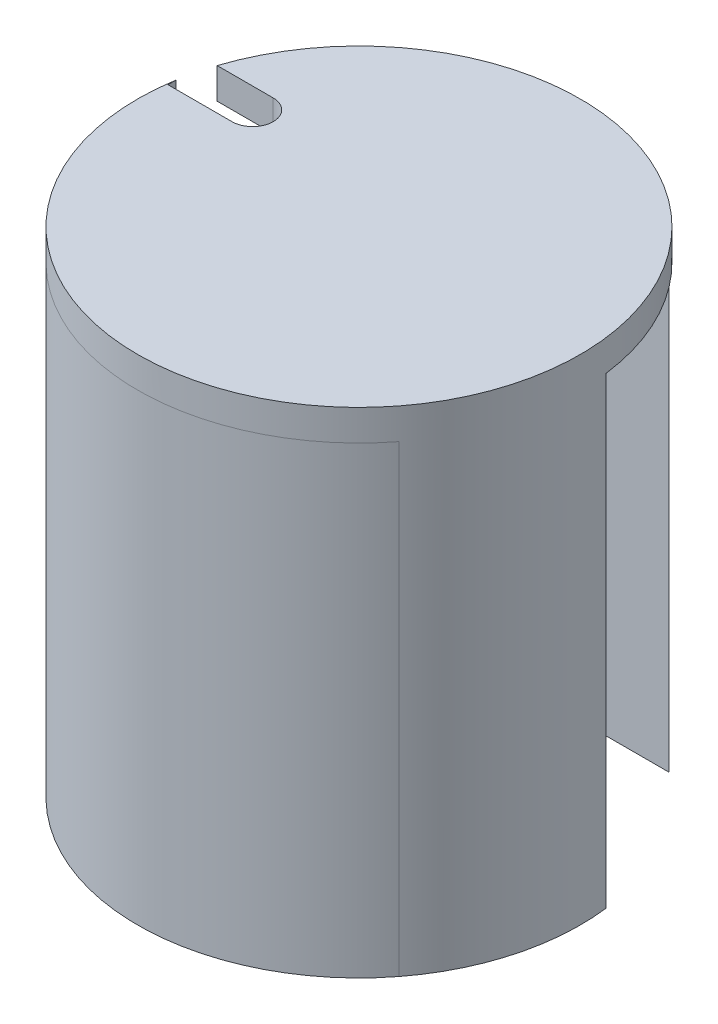
from build123d import *

# Parameters (mm, degrees)
EXTRUDE_7_DEPTH     = 45
EXTRUDE_7_2_DEPTH   = 45
EXTRUDE_7_3_DEPTH   = 45
SKETCH_2_R          = 21.5
EXTRUDE_12_DEPTH    = 3
EXTRUDE_13_DEPTH    = 3
CUT_EXTRUDE_1_DEPTH = 10


with BuildPart() as part:
    # 草圖1 → 填料-伸長7 (new body)
    with BuildSketch(Plane(origin=(0, 0, 0), x_dir=(1, 0, 0), z_dir=(0, 1, 0))):
        with BuildLine():
            ThreePointArc((22.840306299, 19.335604519), (9.898493508, 23.667043668), (-3.043319283, 19.335604519))
            Line((-3.043319283, 19.335604519), (22.840306299, 19.335604519))
        make_face()
    extrude(amount=EXTRUDE_7_DEPTH)


with BuildPart() as body_2:
    # 草圖1 → Extrude 7 2 (new body)
    with BuildSketch(Plane(origin=(0, 0, 0), x_dir=(1, 0, 0), z_dir=(0, 1, 0))):
        with BuildLine():
            Line((31.232241022, 4.835604519), (-11.435254006, 4.835604519))
            ThreePointArc((-11.435254006, 4.835604519), (-10.843023184, -3.493299548), (-7.12233985, -10.968451442))
            ThreePointArc((-7.12233985, -10.968451442), (-8.127599725, -0.974439135), (0.398493508, 4.335604519))
            Line((0.398493508, 4.335604519), (19.398493508, 4.335604519))
            ThreePointArc((19.398493508, 4.335604519), (27.924586796, -0.974439247), (26.919326713, -10.96845164))
            ThreePointArc((26.919326713, -10.96845164), (30.640010167, -3.493299669), (31.232241022, 4.835604519))
        make_face()
    extrude(amount=EXTRUDE_7_2_DEPTH)



with BuildPart() as body_3:
    # 草圖1 → Extrude 7 3 (new body)
    with BuildSketch(Plane(origin=(0, 0, 0), x_dir=(1, 0, 0), z_dir=(0, 1, 0))):
        with BuildLine():
            ThreePointArc((0.398493508, -14.664395481), (-3.791462839, -13.690488714), (-7.12233985, -10.968451442))
            ThreePointArc((-7.12233985, -10.968451442), (9.898493383, -19.332956332), (26.919326713, -10.96845164))
            ThreePointArc((26.919326713, -10.96845164), (23.588449742, -13.690488769), (19.398493508, -14.664395481))
            Line((19.398493508, -14.664395481), (0.398493508, -14.664395481))
        make_face()
    extrude(amount=EXTRUDE_7_3_DEPTH)


with BuildPart() as body_4:
    # 草圖2 → 填料-伸長12 (new body)
    with BuildSketch(Plane(origin=(0, 45, 0), x_dir=(1, 0, 0), z_dir=(0, 1, 0))):
        with Locations((9.898493508, 2.167043668)):
            Circle(SKETCH_2_R)
    extrude(amount=EXTRUDE_12_DEPTH)


with BuildPart() as body_2_1:
    add(body_2.part)

    add(body_4.part)  # 填料-伸長13 merges body 4
    # 草圖3 → 填料-伸長13 (add)
    with BuildSketch(Plane(origin=(0, 0, -4.835604519), x_dir=(-1, 0, 0), z_dir=(0, 0, -1))):
        Polygon((2.101506492, 45), (-26.898493508, 45), (-26.898493508, 0), (-24.898493508, 0), (-24.898493508, 42), (0.101506492, 42), (0.101506492, 0), (2.101506492, 0), align=None)
    extrude(amount=EXTRUDE_13_DEPTH)

    # 草圖6 → 除料-伸長1 (cut)
    with BuildSketch(Plane.XZ.offset(-45)):
        with BuildLine():
            Line((-10.541181054, -8.835604519), (-5.101506492, -8.835604519))
            ThreePointArc((-5.101506492, -8.835604519), (-3.101506492, -6.835604519), (-5.101506492, -4.835604519))
            Line((-5.101506492, -4.835604519), (-11.324408174, -4.835604519))
            Line((-11.324408174, -4.835604519), (-11.324408174, -5.607747693))
            ThreePointArc((-11.324408174, -5.607747693), (-10.99522157, -7.236823768), (-10.541181054, -8.835604519))
        make_face()
    extrude(amount=-CUT_EXTRUDE_1_DEPTH, mode=Mode.SUBTRACT)


solid = Compound([part.part, body_3.part, body_2_1.part])
